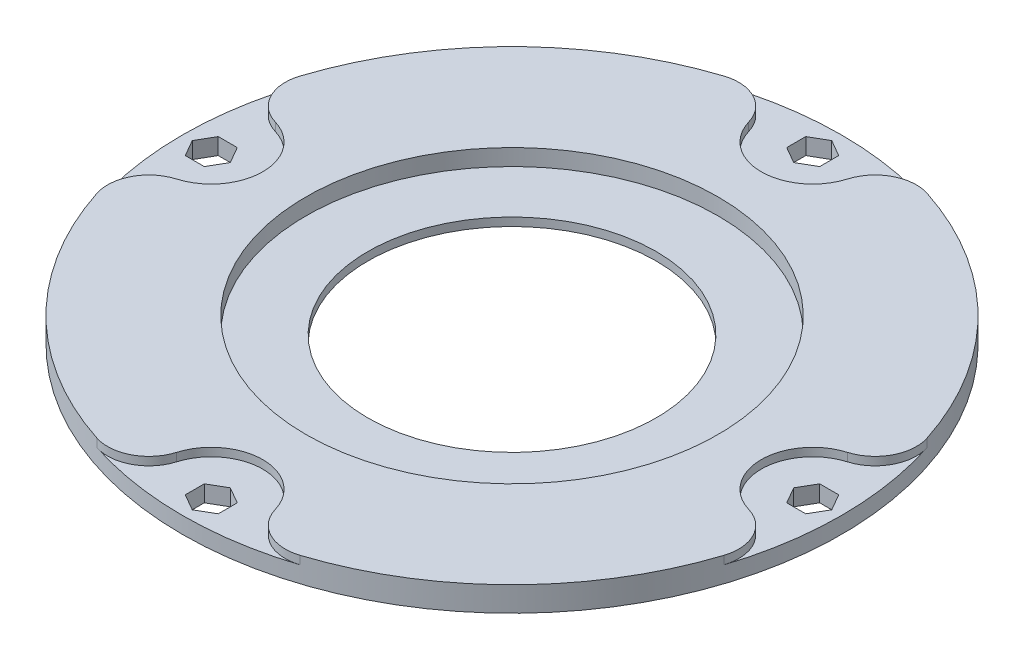
from build123d import *

# Parameters (mm, degrees)
SKETCH1_R           = 80
SKETCH1_R_2         = 50
BOSS_EXTRUDE1_DEPTH = 2
BOSS_EXTRUDE2_START = 4
SKETCH2_R           = 80
SKETCH2_R_2         = 35
BOSS_EXTRUDE2_DEPTH = 4
SKETCH3_R           = 12.5
CUT_EXTRUDE1_DEPTH  = 2
FILLET1_R           = 10
CUT_EXTRUDE2_DEPTH  = 114.20777373
MOVE_FACE1_BY       = 2


with BuildPart() as part:
    # Sketch1 → Boss-Extrude1 (new body)
    with BuildSketch(Plane(origin=(0, 0, 0), x_dir=(1, 0, 0), z_dir=(0, 1, 0))):
        Circle(SKETCH1_R)
        Circle(SKETCH1_R_2, mode=Mode.SUBTRACT)
    extrude(amount=BOSS_EXTRUDE1_DEPTH)

    # Sketch2 → Boss-Extrude2 (add)
    with BuildSketch(Plane.XZ.offset(BOSS_EXTRUDE2_START)):
        Circle(SKETCH2_R)
        Circle(SKETCH2_R_2, mode=Mode.SUBTRACT)
    extrude(amount=-BOSS_EXTRUDE2_DEPTH)

    # Sketch3 → Cut-Extrude1 (cut)
    with BuildSketch(Plane(origin=(0, 2, 0), x_dir=(1, 0, 0), z_dir=(0, 1, 0))):
        with Locations((0, 73)):
            Circle(SKETCH3_R)
        with Locations((73, 0)):
            Circle(SKETCH3_R)
        with Locations((0, -73)):
            Circle(SKETCH3_R)
        with Locations((-73, 0)):
            Circle(SKETCH3_R)
    extrude(amount=-CUT_EXTRUDE1_DEPTH, mode=Mode.SUBTRACT)

    # Fillet1
    fillet1_edges = [part.edges().sort_by_distance(p)[0] for p in [
        (79.265410959, 1, 10.816405388),
        (79.265410959, 1, -10.816405388),
        (10.816405388, 1, 79.265410959),
        (-10.816405388, 1, 79.265410959),
        (-79.265410959, 1, -10.816405388),
        (-79.265410959, 1, 10.816405388),
        (10.816405388, 1, -79.265410959),
        (-10.816405388, 1, -79.265410959),
    ]]
    fillet(fillet1_edges, radius=FILLET1_R)

    # Sketch4 → Cut-Extrude2 (cut, through all)
    with BuildSketch(Plane(origin=(0, 0, 0), x_dir=(1, 0, 0), z_dir=(0, 1, 0))):
        Polygon((-4, 70.690598923), (-4, 75.309401077), (0, 77.618802154), (4, 75.309401077), (4, 70.690598923), (0, 68.381197846), align=None)
        Polygon((70.690598923, -4), (68.381197846, 0), (70.690598923, 4), (75.309401077, 4), (77.618802154, 0), (75.309401077, -4), align=None)
        Polygon((-4, -70.690598923), (0, -68.381197846), (4, -70.690598923), (4, -75.309401077), (0, -77.618802154), (-4, -75.309401077), align=None)
        Polygon((-70.690598923, 4), (-68.381197846, 0), (-70.690598923, -4), (-75.309401077, -4), (-77.618802154, 0), (-75.309401077, 4), align=None)
    extrude(amount=-CUT_EXTRUDE2_DEPTH, mode=Mode.SUBTRACT)

    # Move Face1: a face moved inward by 2.0
    extrude(part.faces().sort_by_distance((0, 0, -40))[0], amount=MOVE_FACE1_BY, dir=(0, -1, 0), mode=Mode.SUBTRACT)


solid = part.part
